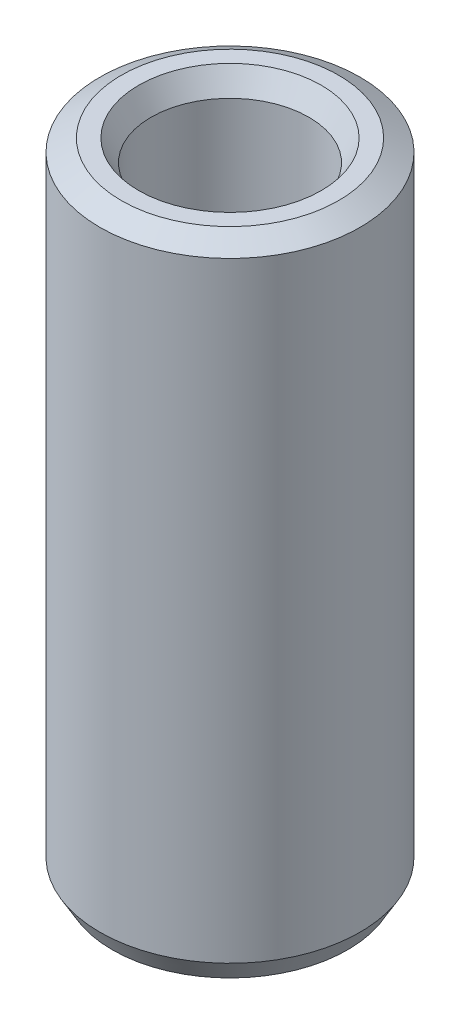
from build123d import *
from OCP.BRepFilletAPI import BRepFilletAPI_MakeChamfer

# Parameters (mm, degrees)
SKETCH1_R           = 22.5
BOSS_EXTRUDE1_DEPTH = 111.401906016
SKETCH2_R           = 13.641663645
CUT_EXTRUDE1_DEPTH  = 116.857173554
CHAMFER1_SIZE       = 2.145059925
CHAMFER1_SIZE2      = 3.715352776


with BuildPart() as part:
    # Sketch1 → Boss-Extrude1 (new body)
    with BuildSketch(Plane(origin=(0, 0, 0), x_dir=(1, 0, 0), z_dir=(0, 1, 0))):
        Circle(SKETCH1_R)
    extrude(amount=BOSS_EXTRUDE1_DEPTH)

    # Sketch2 → Cut-Extrude1 (cut, through all)
    with BuildSketch(Plane(origin=(0, 0, 0), x_dir=(1, 0, 0), z_dir=(0, 1, 0))):
        Circle(SKETCH2_R)
    extrude(amount=CUT_EXTRUDE1_DEPTH, mode=Mode.SUBTRACT)

    # Chamfer1: one chamfer whose edges measure the first distance from different faces: ONE call of the kernel's chamfer builder (chamfer() names one face for all edges)
    chamfer1_edges_1 = [part.edges().sort_by_distance(p)[0] for p in [
        (-13.641663645, 111.401906016, 0),
    ]]
    chamfer1_side_1 = [part.faces().sort_by_distance(p)[0] for p in [
        (-21.863603897, 111.401906016, 0),
    ]]
    chamfer1_edges_2 = [part.edges().sort_by_distance(p)[0] for p in [
        (-13.641663645, 0, 0),
    ]]
    chamfer1_side_2 = [part.faces().sort_by_distance(p)[0] for p in [
        (-13.641663645, 55.700953008, 0),
    ]]
    chamfer1_edges_3 = [part.edges().sort_by_distance(p)[0] for p in [
        (-22.5, 0, 0),
    ]]
    chamfer1_side_3 = [part.faces().sort_by_distance(p)[0] for p in [
        (-21.863603897, 0, 0),
    ]]
    chamfer1_edges_4 = [part.edges().sort_by_distance(p)[0] for p in [
        (-22.5, 111.401906016, 0),
    ]]
    chamfer1_side_4 = [part.faces().sort_by_distance(p)[0] for p in [
        (-22.5, 55.700953008, 0),
    ]]
    chamfer1 = BRepFilletAPI_MakeChamfer(part.part.solid().wrapped)
    for e in chamfer1_edges_1:
        chamfer1.Add(CHAMFER1_SIZE, CHAMFER1_SIZE2, e.wrapped, chamfer1_side_1[0].wrapped)  # the first distance lies on this face
    for e in chamfer1_edges_2:
        chamfer1.Add(CHAMFER1_SIZE, CHAMFER1_SIZE2, e.wrapped, chamfer1_side_2[0].wrapped)  # the first distance lies on this face
    for e in chamfer1_edges_3:
        chamfer1.Add(CHAMFER1_SIZE, CHAMFER1_SIZE2, e.wrapped, chamfer1_side_3[0].wrapped)  # the first distance lies on this face
    for e in chamfer1_edges_4:
        chamfer1.Add(CHAMFER1_SIZE, CHAMFER1_SIZE2, e.wrapped, chamfer1_side_4[0].wrapped)  # the first distance lies on this face
    add(Compound.cast(chamfer1.Shape()), mode=Mode.REPLACE)


solid = part.part
